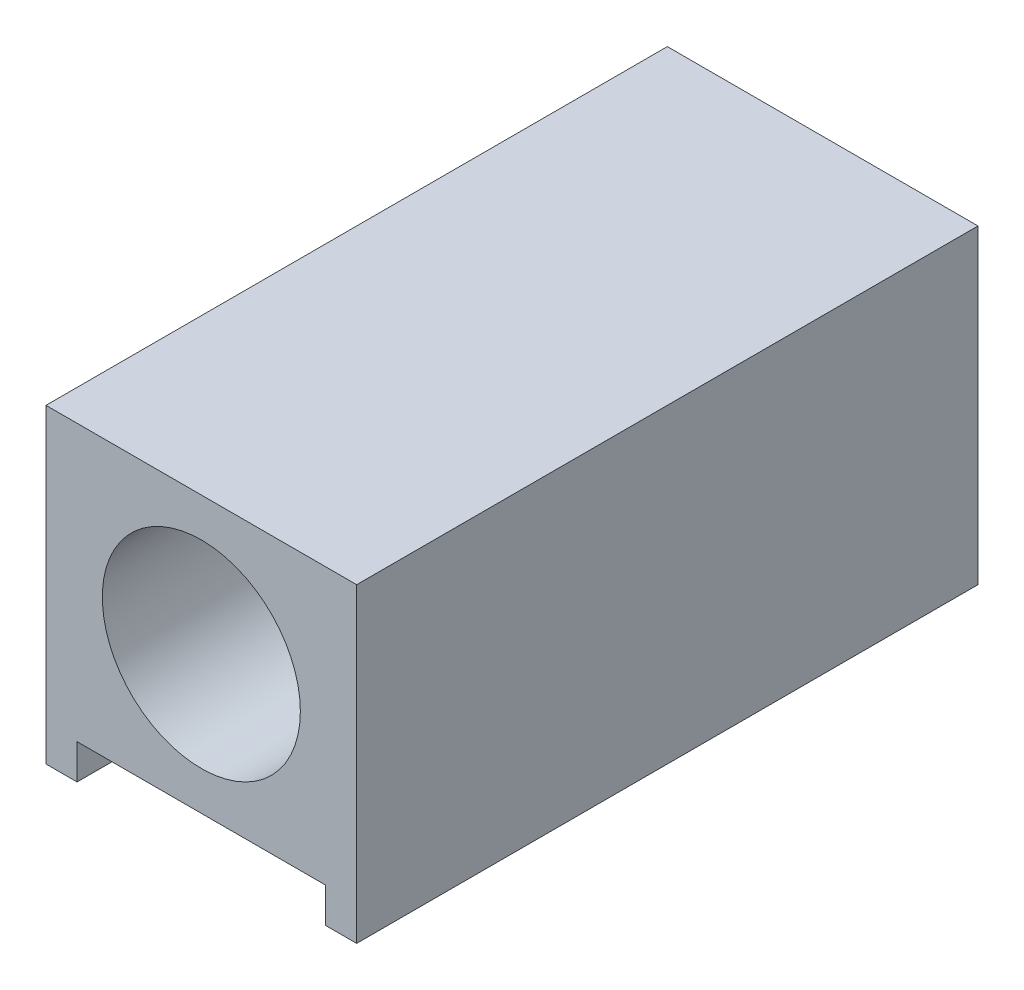
from build123d import *

# Parameters (mm, degrees)
SKETCH1_W           = 16
SKETCH1_H           = 32
BOSS_EXTRUDE1_DEPTH = 14.2
SKETCH3_W           = 1.6
SKETCH3_H           = 32
BOSS_EXTRUDE2_DEPTH = 1.8
SKETCH4_R           = 5.1
CUT_EXTRUDE1_DEPTH  = 37.567372703
SKETCH5_W           = 5.4
SKETCH5_H           = 1.6
BOSS_EXTRUDE3_DEPTH = 13
FILLET1_R           = 1


with BuildPart() as part:
    # Sketch1 → Boss-Extrude1 (new body)
    with BuildSketch(Plane(origin=(0, 0, 0), x_dir=(1, 0, 0), z_dir=(0, 1, 0))):
        with Locations((-2.560906516, 3.28611898)):
            Rectangle(SKETCH1_W, SKETCH1_H)
    extrude(amount=BOSS_EXTRUDE1_DEPTH)

    # Sketch3 → Boss-Extrude2 (add)
    with BuildSketch(Plane.XZ):
        with Locations((-9.760906516, -3.28611898)):
            Rectangle(SKETCH3_W, SKETCH3_H)
        with Locations((4.639093484, -3.28611898)):
            Rectangle(SKETCH3_W, SKETCH3_H)
    extrude(amount=BOSS_EXTRUDE2_DEPTH)

    # Sketch4 → Cut-Extrude1 (cut, through all)
    with BuildSketch(Plane.XY.offset(12.71388102)):
        with Locations((-2.560906516, 7.1)):
            Circle(SKETCH4_R)
    extrude(amount=-CUT_EXTRUDE1_DEPTH, mode=Mode.SUBTRACT)

    # Sketch5 → Boss-Extrude3 (add)
    with BuildSketch(Plane.XZ):
        with Locations((1.139093484, -18.48611898)):
            Rectangle(SKETCH5_W, SKETCH5_H)
        with Locations((-6.260906516, -18.48611898)):
            Rectangle(SKETCH5_W, SKETCH5_H)
    extrude(amount=-BOSS_EXTRUDE3_DEPTH)

    # Fillet1
    fillet1_edges = [part.edges().sort_by_distance(p)[0] for p in [
        (-3.560906516, 12.1009999, -18.48611898),
        (-3.560906516, 2.0990001, -18.48611898),
        (-1.560906516, 12.1009999, -18.48611898),
        (-1.560906516, 2.0990001, -18.48611898),
    ]]
    fillet(fillet1_edges, radius=FILLET1_R - 0.0001)  # a hair under: the kernel refuses the full size


solid = part.part
